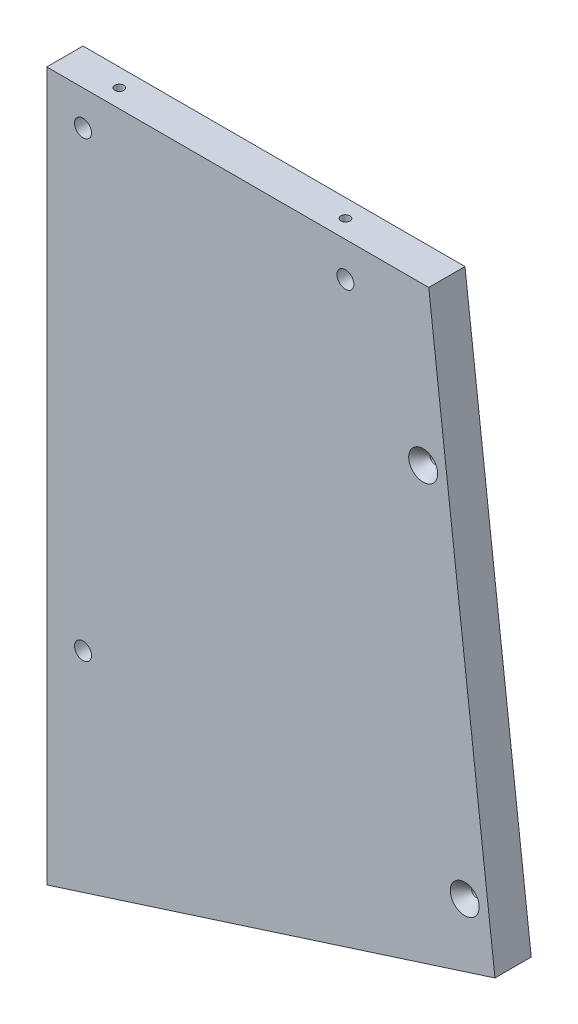
from build123d import *

# Parameters (mm, degrees)
BOSS_EXTRUDE1_DEPTH              = 12.7
HOLE3_D                          = 3.175
HOLE3_DEPTH                      = 31.75
HOLE3_CSINK_D                    = 10.16
HOLE3_CSINK_ANGLE                = 82
HOLE3_TIP                        = 0.953866233
HOLE6_D                          = 3.175
HOLE6_DEPTH                      = 38.1
HOLE6_CSINK_D                    = 10.16
HOLE6_CSINK_ANGLE                = 82
HOLE6_TIP                        = 0.953866233
HOLE7_D                          = 3.175
HOLE7_DEPTH                      = 31.75
HOLE7_CSINK_D                    = 10.16
HOLE7_CSINK_ANGLE                = 82
HOLE7_TIP                        = 0.953866233
HOLE8_D                          = 3.175
HOLE8_DEPTH                      = 31.75
HOLE8_CSINK_D                    = 10.16
HOLE8_CSINK_ANGLE                = 82
HOLE8_TIP                        = 0.953866233
F_15_64_0_23438_DIAMETER_HOLE1_D = 5.953252
F_15_64_0_23438_DIAMETER_HOLE2_D = 5.953252


with BuildPart() as part:
    # Sketch1 → Boss-Extrude1 (new body)
    with BuildSketch(Plane.XY):
        Polygon((-88.190159952, 0), (-222.052967181, 0), (-222.052967181, -248.25), (-64.977416983, -197.966048293), align=None)
    extrude(amount=-BOSS_EXTRUDE1_DEPTH)

    # Hole3
    with Locations(Plane(origin=(-234.752967181, 1073.364195846, -135.816741379), x_dir=(0, 0, -1), z_dir=(-1, 0, 0))):
        with Locations((-129.466741379, 1300.662770337), (-129.466741379, 1128.612770337), (129.198788767, 1128.612770337), (129.198788767, 1300.662770337)):
            CounterSinkHole(HOLE3_D / 2, HOLE3_CSINK_D / 2, depth=HOLE3_DEPTH, counter_sink_angle=HOLE3_CSINK_ANGLE)
            with Locations((0, 0, -(HOLE3_DEPTH + HOLE3_TIP / 2))):  # 118° drill point
                Cone(0, HOLE3_D / 2, HOLE3_TIP, mode=Mode.SUBTRACT)

    # Hole6
    with Locations(Plane(origin=(181.039434513, 1073.364195846, 0), x_dir=(-0.9271838545667885, -0.3746065934159093, 0), z_dir=(0, 0, 1))):
        with Locations((707.166557203, 1065.270372796), (674.127983646, 944.603090451)):
            CounterSinkHole(HOLE6_D / 2, HOLE6_CSINK_D / 2, depth=HOLE6_DEPTH, counter_sink_angle=HOLE6_CSINK_ANGLE)
            with Locations((0, 0, -(HOLE6_DEPTH + HOLE6_TIP / 2))):  # 118° drill point
                Cone(0, HOLE6_D / 2, HOLE6_TIP, mode=Mode.SUBTRACT)

    # Hole7
    with Locations(Plane(origin=(181.039434513, 12.7, -135.816741379), x_dir=(0, 0, -1), z_dir=(0, 1, 0))):
        with Locations((129.198788767, 384.042401694), (-129.466741379, 384.042401694), (-129.466741379, 304.786761906), (-110.416741379, 409.442401694), (-0.133976306, 409.442401694), (110.148788767, 409.442401694), (129.198788767, 304.786761906)):
            CounterSinkHole(HOLE7_D / 2, HOLE7_CSINK_D / 2, depth=HOLE7_DEPTH, counter_sink_angle=HOLE7_CSINK_ANGLE)
            with Locations((0, 0, -(HOLE7_DEPTH + HOLE7_TIP / 2))):  # 118° drill point
                Cone(0, HOLE7_D / 2, HOLE7_TIP, mode=Mode.SUBTRACT)

    # Hole8
    with Locations(Plane(origin=(531.197640696, -20.449854654, -135.816741379), x_dir=(0, 0, 1), z_dir=(0.3048844921716131, -0.9523893355310409, 0))):
        with Locations((-129.257383629, 761.035393152), (129.466741379, 663.01461615), (129.466741379, 760.835922116), (-129.408220012, 663.214203478)):
            CounterSinkHole(HOLE8_D / 2, HOLE8_CSINK_D / 2, depth=HOLE8_DEPTH, counter_sink_angle=HOLE8_CSINK_ANGLE)
            with Locations((0, 0, -(HOLE8_DEPTH + HOLE8_TIP / 2))):  # 118° drill point
                Cone(0, HOLE8_D / 2, HOLE8_TIP, mode=Mode.SUBTRACT)

    # 15/64 (0.23438) Diameter Hole1 (through all)
    with Locations(Plane.XY):
        with Locations((-117.397327393, -12.179479032), (-209.352967181, -12.179479032)):
            Hole(F_15_64_0_23438_DIAMETER_HOLE1_D / 2)

    # 15/64 (0.23438) Diameter Hole2 (through all)
    with Locations(Plane.XY):
        with Locations((-209.352967181, -170.846075828)):
            Hole(F_15_64_0_23438_DIAMETER_HOLE2_D / 2)


solid = part.part
